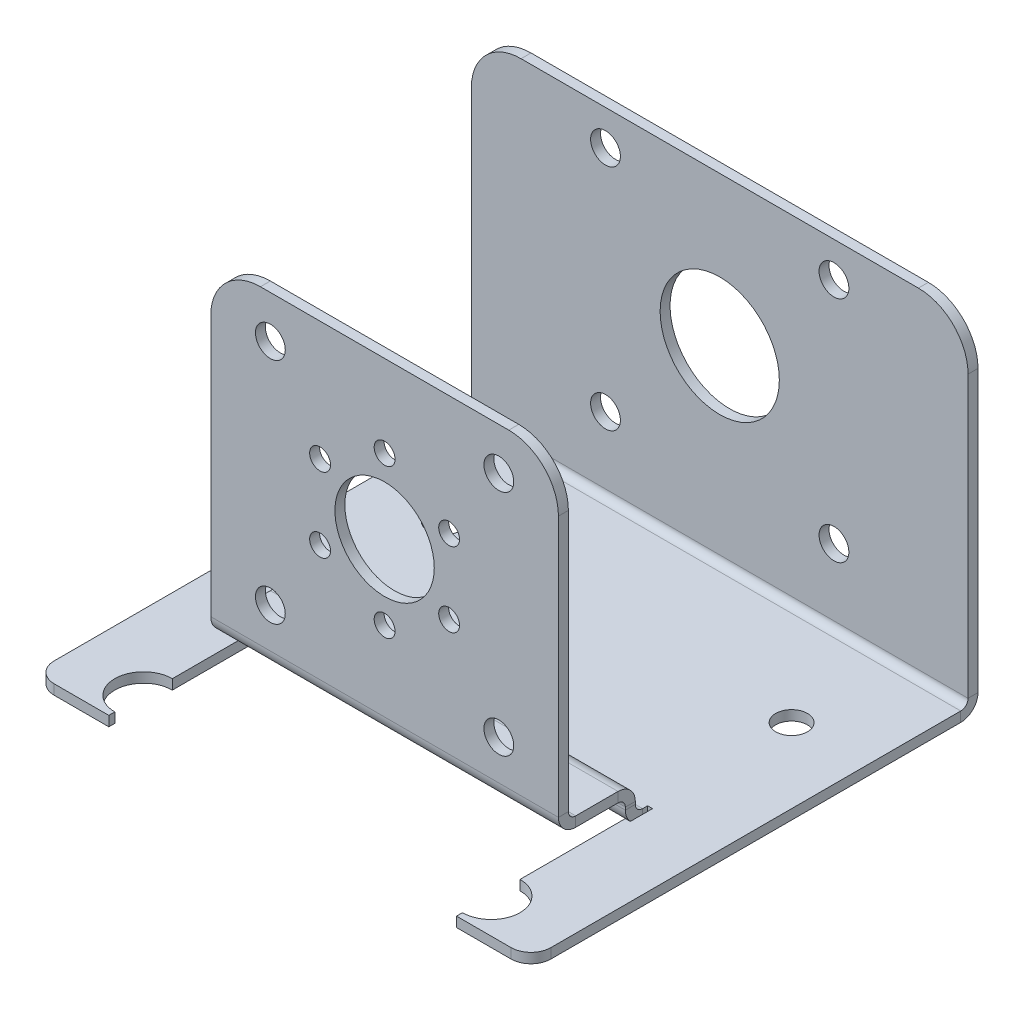
from build123d import *

# Parameters (mm, degrees)
SM_BASE_FLANGE_1_DEPTH           = 1
SM_START                         = -18
SM_EDGE_FLANGE_1_DEPTH           = 36
SM_EDGE_FLANGE_1_2_DEPTH         = 0.5
SM_START_2                       = 17.5
SM_EDGE_FLANGE_1_3_DEPTH         = 0.5
SM_START_3                       = -17.5
SM_EDGE_FLANGE_1_4_DEPTH         = 35
SM_EDGE_FLANGE_3_DEPTH           = 35
SM_EDGE_FLANGE_4_DEPTH           = 35
CUT_EXTRUDE_1_REACH              = 57.12
SKETCH_10_R                      = 1.05
SKETCH_10_R_2                    = 5
SM_EDGE_FLANGE_2_STRIP_W         = 5.4732
SM_EDGE_FLANGE_2_STRIP_H         = 1
SM_EDGE_FLANGE_2_STRIP_CUT_DEPTH = 50
SM_EDGE_FLANGE_2_DEPTH           = 50
CUT_EXTRUDE_2_REACH              = 57.12
SKETCH_10_3_R                    = 1.5
CUT_EXTRUDE_3_REACH              = 64.102
SKETCH_18_R                      = 6
FILLET_1_R                       = 5
CUT_EXTRUDE_6_REACH              = 50.352
SKETCH_19_R                      = 2.9
SKETCH_19_R_2                    = 1.6
FILLET_2_R                       = 2


# Read off the part's stored shape, not the designer's step: 边线-法兰1
# Sheet-metal steps are written as plain solids
with BuildPart() as part:
    # Sketch 2 → 基体-法兰1 (new body)
    with BuildSketch(Plane(origin=(0, 0, 0), x_dir=(1, 0, 0), z_dir=(0, 1, 0))):
        Polygon((-17.5, -5.5), (17.5, -5.5), (17.5, -22.5), (25, -22.5), (25, 22.5), (-25, 22.5), (-25, -22.5), (-17.5, -22.5), align=None)
    extrude(amount=-SM_BASE_FLANGE_1_DEPTH)

    # 边线-法兰1 outline → 边线-法兰1 (cut)
    with BuildSketch(Plane.YZ.offset(SM_START)):
        with BuildLine():
            Line((0, 5.5), (-1, 5.5))
            Line((-1, 5.5), (-1, 3.7634))
            ThreePointArc((-1, 3.7634), (-0.728828115, 4.695226164), (0, 5.33604109))
            Line((0, 5.33604109), (0, 5.5))
        make_face()
    extrude(amount=SM_EDGE_FLANGE_1_DEPTH, mode=Mode.SUBTRACT)

    # Sm Edge Flange 1 2 outline → Sm Edge Flange 1 2 (cut)
    with BuildSketch(Plane.YZ.offset(SM_START)):
        with BuildLine():
            ThreePointArc((0, 5.33604109), (-0.728828115, 4.695226164), (-1, 3.7634))
            Line((-1, 3.7634), (-1, 3.2634))
            Line((-1, 3.2634), (0, 3.2634))
            Line((0, 3.2634), (0, 5.33604109))
        make_face()
    extrude(amount=SM_EDGE_FLANGE_1_2_DEPTH, mode=Mode.SUBTRACT)

    # Sm Edge Flange 1 3 outline → Sm Edge Flange 1 3 (cut)
    with BuildSketch(Plane.YZ.offset(SM_START_2)):
        with BuildLine():
            ThreePointArc((0, 5.33604109), (-0.728828115, 4.695226164), (-1, 3.7634))
            Line((-1, 3.7634), (-1, 3.2634))
            Line((-1, 3.2634), (0, 3.2634))
            Line((0, 3.2634), (0, 5.33604109))
        make_face()
    extrude(amount=SM_EDGE_FLANGE_1_3_DEPTH, mode=Mode.SUBTRACT)

    # Sm Edge Flange 1 4 outline → Sm Edge Flange 1 4 (add)
    with BuildSketch(Plane.YZ.offset(SM_START_3)):
        with BuildLine():
            ThreePointArc((0.7366, 5.5), (0.359286442, 5.458514757), (0, 5.33604109))
            Line((0, 5.33604109), (0, 3.7634))
            ThreePointArc((0, 3.7634), (0.215745145, 4.284254855), (0.7366, 4.5))
            Line((0.7366, 4.5), (1, 4.5))
            Line((1, 4.5), (1, 5.5))
            Line((1, 5.5), (0.7366, 5.5))
        make_face()
    extrude(amount=SM_EDGE_FLANGE_1_4_DEPTH)

    # 边线-法兰3 section (across the edge) → 边线-法兰3 (add)
    with BuildSketch(Plane(origin=(17.5, 1.7366, 5.5), x_dir=(0, -1, 0), z_dir=(-1, 0, 0))):
        with BuildLine():
            Line((-1, 0.7366), (-1, 5))
            Line((-1, 5), (0, 5))
            Line((0, 5), (0, 0.7366))
            ThreePointArc((0, 0.7366), (0.215745145, 0.215745145), (0.7366, 0))
            Line((0.7366, 0), (0.7366, -1))
            ThreePointArc((0.7366, -1), (-0.491361636, -0.491361636), (-1, 0.7366))
        make_face()
    extrude(amount=SM_EDGE_FLANGE_3_DEPTH)

    # 边线-法兰4 section (across the edge) → 边线-法兰4 (add)
    with BuildSketch(Plane(origin=(-17.5, 2.7366, 11.2366), x_dir=(0, 0, -1), z_dir=(1, 0, 0))):
        with BuildLine():
            Line((-1, 0.7366), (-1, 32))
            Line((-1, 32), (0, 32))
            Line((0, 32), (0, 0.7366))
            ThreePointArc((0, 0.7366), (0.215745145, 0.215745145), (0.7366, 0))
            Line((0.7366, 0), (0.7366, -1))
            ThreePointArc((0.7366, -1), (-0.491361636, -0.491361636), (-1, 0.7366))
        make_face()
    extrude(amount=SM_EDGE_FLANGE_4_DEPTH)

    # 草图10 → 切除-拉伸1 (cut, up to next)
    with BuildSketch(Plane.XY.offset(12.2366), mode=Mode.PRIVATE) as cut_extrude_1_sk1:
        with Locations((0, 26.4732)):
            Circle(SKETCH_10_R)
    cut_extrude_1_tool1 = extrude(cut_extrude_1_sk1.sketch, amount=-CUT_EXTRUDE_1_REACH, mode=Mode.PRIVATE) & part.part
    # 草图10 → 切除-拉伸1 (cut, up to next)
    with BuildSketch(Plane.XY.offset(12.2366), mode=Mode.PRIVATE) as cut_extrude_1_sk2:
        with Locations((-6.495190528, 22.7232)):
            Circle(SKETCH_10_R)
    cut_extrude_1_tool2 = extrude(cut_extrude_1_sk2.sketch, amount=-CUT_EXTRUDE_1_REACH, mode=Mode.PRIVATE) & part.part
    # 草图10 → 切除-拉伸1 (cut, up to next)
    with BuildSketch(Plane.XY.offset(12.2366), mode=Mode.PRIVATE) as cut_extrude_1_sk3:
        with Locations((-6.495190528, 15.2232)):
            Circle(SKETCH_10_R)
    cut_extrude_1_tool3 = extrude(cut_extrude_1_sk3.sketch, amount=-CUT_EXTRUDE_1_REACH, mode=Mode.PRIVATE) & part.part
    # 草图10 → 切除-拉伸1 (cut, up to next)
    with BuildSketch(Plane.XY.offset(12.2366), mode=Mode.PRIVATE) as cut_extrude_1_sk4:
        with Locations((0, 18.9732)):
            Circle(SKETCH_10_R_2)
    cut_extrude_1_tool4 = extrude(cut_extrude_1_sk4.sketch, amount=-CUT_EXTRUDE_1_REACH, mode=Mode.PRIVATE) & part.part
    # 草图10 → 切除-拉伸1 (cut, up to next)
    with BuildSketch(Plane.XY.offset(12.2366), mode=Mode.PRIVATE) as cut_extrude_1_sk5:
        with Locations((0, 11.4732)):
            Circle(SKETCH_10_R)
    cut_extrude_1_tool5 = extrude(cut_extrude_1_sk5.sketch, amount=-CUT_EXTRUDE_1_REACH, mode=Mode.PRIVATE) & part.part
    # 草图10 → 切除-拉伸1 (cut, up to next)
    with BuildSketch(Plane.XY.offset(12.2366), mode=Mode.PRIVATE) as cut_extrude_1_sk6:
        with Locations((6.495190528, 15.2232)):
            Circle(SKETCH_10_R)
    cut_extrude_1_tool6 = extrude(cut_extrude_1_sk6.sketch, amount=-CUT_EXTRUDE_1_REACH, mode=Mode.PRIVATE) & part.part
    # 草图10 → 切除-拉伸1 (cut, up to next)
    with BuildSketch(Plane.XY.offset(12.2366), mode=Mode.PRIVATE) as cut_extrude_1_sk7:
        with Locations((6.495190528, 22.7232)):
            Circle(SKETCH_10_R)
    cut_extrude_1_tool7 = extrude(cut_extrude_1_sk7.sketch, amount=-CUT_EXTRUDE_1_REACH, mode=Mode.PRIVATE) & part.part
    add(cut_extrude_1_tool1.solids().sort_by_distance((0, 26.4732, 12.2366))[0], mode=Mode.SUBTRACT)
    add(cut_extrude_1_tool2.solids().sort_by_distance((-6.495191, 22.7232, 12.2366))[0], mode=Mode.SUBTRACT)
    add(cut_extrude_1_tool3.solids().sort_by_distance((-6.495191, 15.2232, 12.2366))[0], mode=Mode.SUBTRACT)
    add(cut_extrude_1_tool4.solids().sort_by_distance((0, 18.9732, 12.2366))[0], mode=Mode.SUBTRACT)
    add(cut_extrude_1_tool5.solids().sort_by_distance((0, 11.4732, 12.2366))[0], mode=Mode.SUBTRACT)
    add(cut_extrude_1_tool6.solids().sort_by_distance((6.495191, 15.2232, 12.2366))[0], mode=Mode.SUBTRACT)
    add(cut_extrude_1_tool7.solids().sort_by_distance((6.495191, 22.7232, 12.2366))[0], mode=Mode.SUBTRACT)

    # 边线-法兰2 strip (across the edge) → 边线-法兰2 strip cut (cut)
    with BuildSketch(Plane(origin=(25, 0, -22.5), x_dir=(0, 0, 1), z_dir=(-1, 0, 0))):
        with Locations((-1, -0.5)):
            Rectangle(SM_EDGE_FLANGE_2_STRIP_W, SM_EDGE_FLANGE_2_STRIP_H)
    extrude(amount=SM_EDGE_FLANGE_2_STRIP_CUT_DEPTH, mode=Mode.SUBTRACT)

    # 边线-法兰2 section (across the edge) → 边线-法兰2 (add)
    with BuildSketch(Plane(origin=(25, 0, -22.5), x_dir=(0, 0, 1), z_dir=(-1, 0, 0))):
        with BuildLine():
            Line((0, 0.7366), (0, 34))
            Line((0, 34), (1, 34))
            Line((1, 34), (1, 0.7366))
            ThreePointArc((1, 0.7366), (1.215745145, 0.215745145), (1.7366, 0))
            Line((1.7366, 0), (1.7366, -1))
            ThreePointArc((1.7366, -1), (0.508638364, -0.491361636), (0, 0.7366))
        make_face()
    extrude(amount=SM_EDGE_FLANGE_2_DEPTH)

    # 切除-拉伸2: up to this face of the body (flat: up to its plane)
    cut_extrude_2_end = Plane(part.part.faces().sort_by_distance((0, 17.3683, -22.5))[0])
    # 草图10<3> → 切除-拉伸2 (cut, up to the picked face)
    with BuildSketch(Plane.XY.offset(12.2366), mode=Mode.PRIVATE) as cut_extrude_2_sk1:
        with Locations(Location((-11.5, 30.4732, 0), (0, 0, 270))):
            Circle(SKETCH_10_3_R)
    cut_extrude_2_tool1 = split(extrude(cut_extrude_2_sk1.sketch, amount=-CUT_EXTRUDE_2_REACH, mode=Mode.PRIVATE), bisect_by=cut_extrude_2_end, keep=Keep.BOTH, mode=Mode.PRIVATE)
    # 草图10<3> → 切除-拉伸2 (cut, up to the picked face)
    with BuildSketch(Plane.XY.offset(12.2366), mode=Mode.PRIVATE) as cut_extrude_2_sk2:
        with Locations(Location((-11.5, 7.4732, 0), (0, 0, 270))):
            Circle(SKETCH_10_3_R)
    cut_extrude_2_tool2 = split(extrude(cut_extrude_2_sk2.sketch, amount=-CUT_EXTRUDE_2_REACH, mode=Mode.PRIVATE), bisect_by=cut_extrude_2_end, keep=Keep.BOTH, mode=Mode.PRIVATE)
    # 草图10<3> → 切除-拉伸2 (cut, up to the picked face)
    with BuildSketch(Plane.XY.offset(12.2366), mode=Mode.PRIVATE) as cut_extrude_2_sk3:
        with Locations(Location((11.5, 30.4732, 0), (0, 0, 270))):
            Circle(SKETCH_10_3_R)
    cut_extrude_2_tool3 = split(extrude(cut_extrude_2_sk3.sketch, amount=-CUT_EXTRUDE_2_REACH, mode=Mode.PRIVATE), bisect_by=cut_extrude_2_end, keep=Keep.BOTH, mode=Mode.PRIVATE)
    # 草图10<3> → 切除-拉伸2 (cut, up to the picked face)
    with BuildSketch(Plane.XY.offset(12.2366), mode=Mode.PRIVATE) as cut_extrude_2_sk4:
        with Locations(Location((11.5, 7.4732, 0), (0, 0, 270))):
            Circle(SKETCH_10_3_R)
    cut_extrude_2_tool4 = split(extrude(cut_extrude_2_sk4.sketch, amount=-CUT_EXTRUDE_2_REACH, mode=Mode.PRIVATE), bisect_by=cut_extrude_2_end, keep=Keep.BOTH, mode=Mode.PRIVATE)
    add(cut_extrude_2_tool1.solids().sort_by(Axis((-11.5, 30.4732, 12.2366), (0, 0, -1)))[0], mode=Mode.SUBTRACT)
    add(cut_extrude_2_tool2.solids().sort_by(Axis((-11.5, 7.4732, 12.2366), (0, 0, -1)))[0], mode=Mode.SUBTRACT)
    add(cut_extrude_2_tool3.solids().sort_by(Axis((11.5, 30.4732, 12.2366), (0, 0, -1)))[0], mode=Mode.SUBTRACT)
    add(cut_extrude_2_tool4.solids().sort_by(Axis((11.5, 7.4732, 12.2366), (0, 0, -1)))[0], mode=Mode.SUBTRACT)

    # 草图18 → 切除-拉伸3 (cut, up to next)
    with BuildSketch(Plane(origin=(0, 0, -22.5), x_dir=(-1, 0, 0), z_dir=(0, 0, -1)), mode=Mode.PRIVATE) as cut_extrude_3_sk1:
        with Locations(Location((0, 18.9732, 0), (0, 0, 90))):
            Circle(SKETCH_18_R)
    cut_extrude_3_tool1 = extrude(cut_extrude_3_sk1.sketch, amount=-CUT_EXTRUDE_3_REACH, mode=Mode.PRIVATE) & part.part
    add(cut_extrude_3_tool1.solids().sort_by_distance((0, 18.9732, -22.5))[0], mode=Mode.SUBTRACT)

    # 圆角1
    fillet_1_edges = [part.edges().sort_by_distance(p)[0] for p in [
        (-17.5, 34.7366, 11.7366),
        (17.5, 34.7366, 11.7366),
        (25, 34, -22),
        (-25, 34, -22),
    ]]
    fillet(fillet_1_edges, radius=FILLET_1_R)

    # 草图19 → 切除-拉伸6 (cut, up to next)
    with BuildSketch(Plane(origin=(0, 0, 0), x_dir=(1, 0, 0), z_dir=(0, 1, 0)), mode=Mode.PRIVATE) as cut_extrude_6_sk1:
        with Locations((-17.5, -19)):
            Circle(SKETCH_19_R)
    cut_extrude_6_tool1 = extrude(cut_extrude_6_sk1.sketch, amount=-CUT_EXTRUDE_6_REACH, mode=Mode.PRIVATE) & part.part
    # 草图19 → 切除-拉伸6 (cut, up to next)
    with BuildSketch(Plane(origin=(0, 0, 0), x_dir=(1, 0, 0), z_dir=(0, 1, 0)), mode=Mode.PRIVATE) as cut_extrude_6_sk2:
        with Locations((17.5, -19)):
            Circle(SKETCH_19_R)
    cut_extrude_6_tool2 = extrude(cut_extrude_6_sk2.sketch, amount=-CUT_EXTRUDE_6_REACH, mode=Mode.PRIVATE) & part.part
    # 草图19 → 切除-拉伸6 (cut, up to next)
    with BuildSketch(Plane(origin=(0, 0, 0), x_dir=(1, 0, 0), z_dir=(0, 1, 0)), mode=Mode.PRIVATE) as cut_extrude_6_sk3:
        with Locations(Location((-17.5, 11.2366, 0), (0, 0, 270))):
            Circle(SKETCH_19_R_2)
    cut_extrude_6_tool3 = extrude(cut_extrude_6_sk3.sketch, amount=-CUT_EXTRUDE_6_REACH, mode=Mode.PRIVATE) & part.part
    # 草图19 → 切除-拉伸6 (cut, up to next)
    with BuildSketch(Plane(origin=(0, 0, 0), x_dir=(1, 0, 0), z_dir=(0, 1, 0)), mode=Mode.PRIVATE) as cut_extrude_6_sk4:
        with Locations(Location((17.5, 11.2366, 0), (0, 0, 90))):
            Circle(SKETCH_19_R_2)
    cut_extrude_6_tool4 = extrude(cut_extrude_6_sk4.sketch, amount=-CUT_EXTRUDE_6_REACH, mode=Mode.PRIVATE) & part.part
    # 草图19 → 切除-拉伸6 (cut, up to next)
    with BuildSketch(Plane(origin=(0, 0, 0), x_dir=(1, 0, 0), z_dir=(0, 1, 0)), mode=Mode.PRIVATE) as cut_extrude_6_sk5:
        with Locations(Location((0, 0, 0), (0, 0, 270))):
            Circle(SKETCH_19_R_2)
    cut_extrude_6_tool5 = extrude(cut_extrude_6_sk5.sketch, amount=-CUT_EXTRUDE_6_REACH, mode=Mode.PRIVATE) & part.part
    add(cut_extrude_6_tool1.solids().sort_by_distance((-17.5, 0, 19))[0], mode=Mode.SUBTRACT)
    add(cut_extrude_6_tool2.solids().sort_by_distance((17.5, 0, 19))[0], mode=Mode.SUBTRACT)
    add(cut_extrude_6_tool3.solids().sort_by_distance((-17.5, 0, -11.2366))[0], mode=Mode.SUBTRACT)
    add(cut_extrude_6_tool4.solids().sort_by_distance((17.5, 0, -11.2366))[0], mode=Mode.SUBTRACT)
    add(cut_extrude_6_tool5.solids().sort_by_distance((0, 0, 0))[0], mode=Mode.SUBTRACT)

    # 圆角2
    fillet_2_edges = [part.edges().sort_by_distance(p)[0] for p in [
        (-25, -0.5, 22.5),
        (25, -0.5, 22.5),
    ]]
    fillet(fillet_2_edges, radius=FILLET_2_R)


solid = part.part
